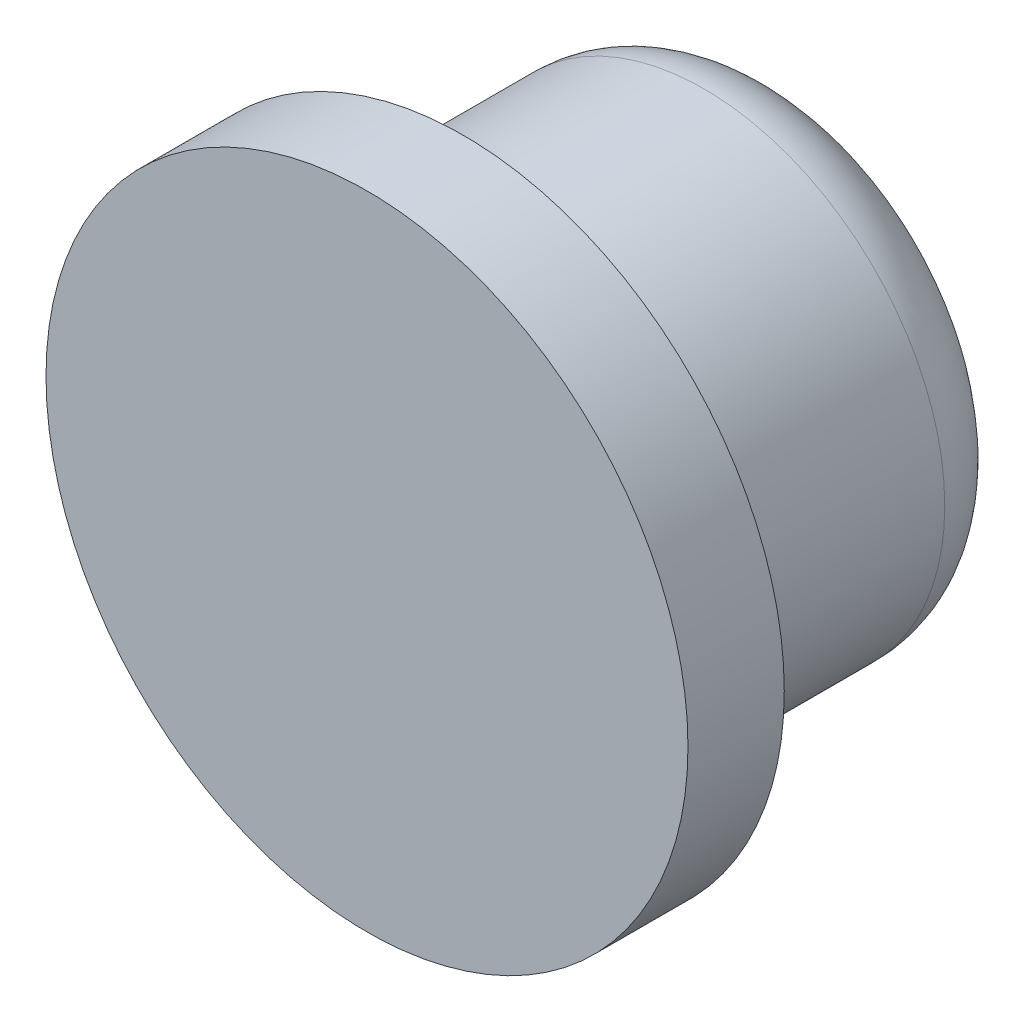
from build123d import *

# Parameters (mm, degrees)
SKETCH1_R           = 10
BOSS_EXTRUDE3_DEPTH = 3
SKETCH3_R           = 7.5
BOSS_EXTRUDE4_DEPTH = 10
FILLET1_R           = 2.5


with BuildPart() as part:
    # Sketch1 → Boss-Extrude3 (new body)
    with BuildSketch(Plane.XY):
        with Locations((-13.989793671, 22.267450219)):
            Circle(SKETCH1_R)
    extrude(amount=BOSS_EXTRUDE3_DEPTH)

    # Sketch3 → Boss-Extrude4 (add)
    with BuildSketch(Plane(origin=(0, 0, 0), x_dir=(-1, 0, 0), z_dir=(0, 0, -1))):
        with Locations((13.989793671, 22.267450219)):
            Circle(SKETCH3_R)
    extrude(amount=BOSS_EXTRUDE4_DEPTH)

    # Fillet1
    fillet1_edges = [part.edges().sort_by_distance(p)[0] for p in [
        (-6.489793671, 22.267450219, -10),
    ]]
    fillet(fillet1_edges, radius=FILLET1_R)


solid = part.part
